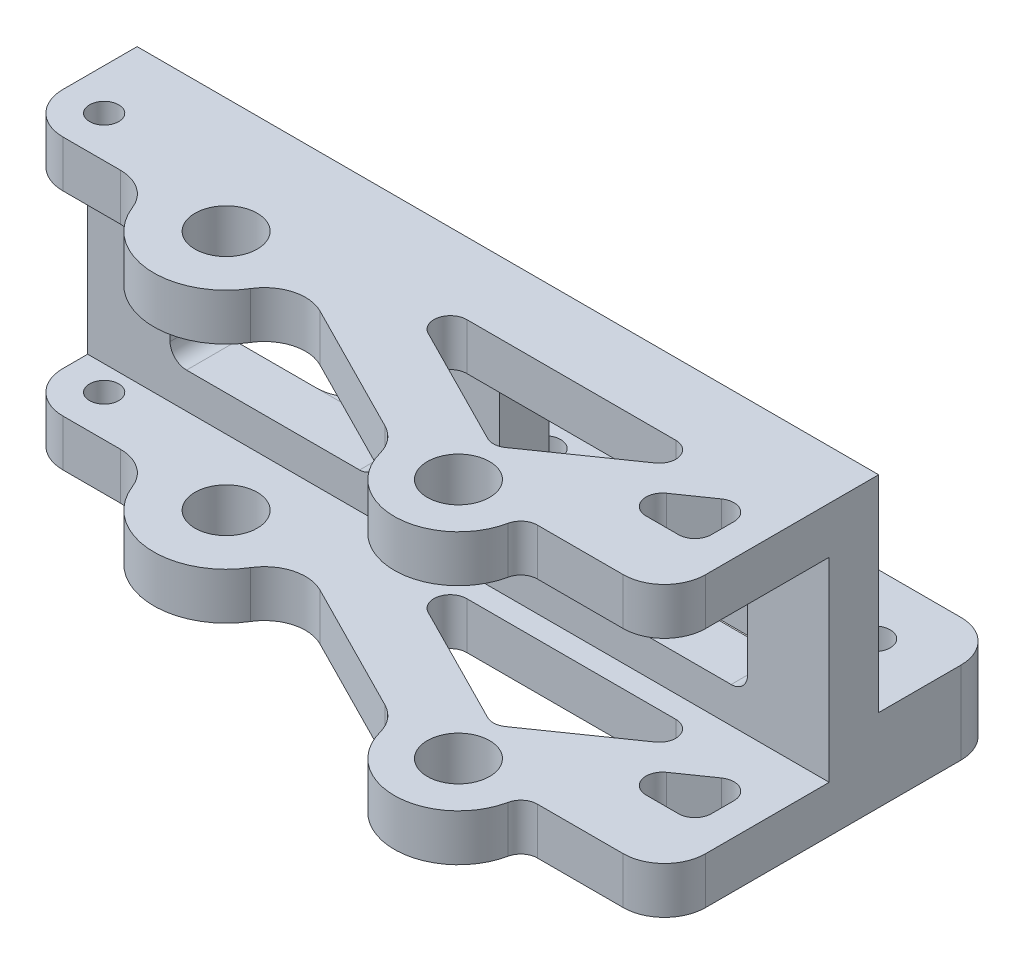
from build123d import *

# Parameters (mm, degrees)
SKETCH1_W               = 114.3
SKETCH1_H               = 44.45
BOSS_EXTRUDE1_DEPTH     = 64.77
SKETCH2_W               = 114.3
SKETCH2_H               = 30.050000124
CUT_EXTRUDE2_DEPTH      = 35.56
SKETCH3_W               = 114.3
SKETCH3_H               = 31.75
CUT_EXTRUDE3_DEPTH      = 21.59
SKETCH5_R               = 2.415
CUT_EXTRUDE4_DEPTH      = 25.4
CUT_EXTRUDE6_REACH      = 99.145
SKETCH7_R               = 4.8
CUT_EXTRUDE7_DEPTH      = 71.884319317
CUT_EXTRUDE7_DEPTH_BACK = 71.884319317
SKETCH9_W               = 31.75
SKETCH9_H               = 30.050000124
CUT_EXTRUDE8_DEPTH      = 98.144623629
BOSS_EXTRUDE2_REACH     = 99.632
SKETCH14_W              = 21.59
SKETCH14_H              = 5.500000062
SKETCH17_W              = 31.75
SKETCH17_H              = 5.500000062
BOSS_EXTRUDE3_DEPTH     = 7.62
SKETCH25_W              = 10.16
SKETCH25_H              = 7.199999938
BOSS_EXTRUDE5_DEPTH     = 20.35
F_8_CLEARANCE_HOLE1_D   = 4.4958
SKETCH31_W              = 114.3
SKETCH31_H              = 12.7
CUT_EXTRUDE9_DEPTH      = 2.54
CUT_EXTRUDE10_DEPTH     = 97.958161596
FILLET2_R               = 2.54
FILLET3_R               = 6.35
CUT_EXTRUDE11_DEPTH     = 97.958161596
SKETCH36_W              = 38.225
SKETCH36_H              = 24.550000062
CUT_EXTRUDE12_DEPTH     = 71.744268496
FILLET1_START           = -22.225
FILLET1_DEPTH           = 7.199999938
FILLET1_START_2         = 15.025000062
FILLET1_2_DEPTH         = 7.199999938
FILLET1_START_3         = -15.025000062
FILLET1_3_DEPTH         = 5.500000062
FILLET4_R               = 2.54


with BuildPart() as part:
    # Sketch1 → Boss-Extrude1 (new body)
    with BuildSketch(Plane.XY):
        Rectangle(SKETCH1_W, SKETCH1_H)
    extrude(amount=BOSS_EXTRUDE1_DEPTH)

    # Sketch2 → Cut-Extrude2 (cut)
    with BuildSketch(Plane.XY.offset(64.77)):
        Rectangle(SKETCH2_W, SKETCH2_H)
    extrude(amount=-CUT_EXTRUDE2_DEPTH, mode=Mode.SUBTRACT)

    # Sketch3 → Cut-Extrude3 (cut)
    with BuildSketch(Plane(origin=(0, 0, 0), x_dir=(-1, 0, 0), z_dir=(0, 0, -1))):
        with Locations((0, 6.35)):
            Rectangle(SKETCH3_W, SKETCH3_H)
    extrude(amount=-CUT_EXTRUDE3_DEPTH, mode=Mode.SUBTRACT)

    # Sketch5 → Cut-Extrude4 (cut)
    with BuildSketch(Plane.XZ.offset(22.225)):
        with Locations((-3.81, 12.06)):
            Circle(SKETCH5_R)
        with Locations((46.99, 12.06)):
            Circle(SKETCH5_R)
    extrude(amount=-CUT_EXTRUDE4_DEPTH, mode=Mode.SUBTRACT)

    # Cut-Extrude6: up to this face of the body (flat: up to its plane)
    cut_extrude6_end = Plane(part.part.faces().sort_by_distance((0, 22.225, 43.18))[0])
    # Sketch7 → Cut-Extrude6 (cut, up to the picked face)
    with BuildSketch(Plane.XZ.offset(22.225), mode=Mode.PRIVATE) as cut_extrude6_sk1:
        with Locations((25.4, 54.61)):
            Circle(SKETCH7_R)
    cut_extrude6_tool1 = split(extrude(cut_extrude6_sk1.sketch, amount=-CUT_EXTRUDE6_REACH, mode=Mode.PRIVATE), bisect_by=cut_extrude6_end, keep=Keep.BOTH, mode=Mode.PRIVATE)
    # Sketch7 → Cut-Extrude6 (cut, up to the picked face)
    with BuildSketch(Plane.XZ.offset(22.225), mode=Mode.PRIVATE) as cut_extrude6_sk2:
        with Locations((-25.65, 39.37)):
            Circle(SKETCH7_R)
    cut_extrude6_tool2 = split(extrude(cut_extrude6_sk2.sketch, amount=-CUT_EXTRUDE6_REACH, mode=Mode.PRIVATE), bisect_by=cut_extrude6_end, keep=Keep.BOTH, mode=Mode.PRIVATE)
    add(cut_extrude6_tool1.solids().sort_by(Axis((25.4, -22.225, 54.61), (0, 1, 0)))[0], mode=Mode.SUBTRACT)
    add(cut_extrude6_tool2.solids().sort_by(Axis((-25.65, -22.225, 39.37), (0, 1, 0)))[0], mode=Mode.SUBTRACT)

    # Sketch9 → Cut-Extrude7 (cut, two sides: drawn at the far end of the back side and taken through both)
    with BuildSketch(Plane.XY.offset(29.21).offset(-CUT_EXTRUDE7_DEPTH_BACK)):
        with Locations((-28.575, 0)):
            Rectangle(SKETCH9_W, SKETCH9_H)
    extrude(amount=CUT_EXTRUDE7_DEPTH + CUT_EXTRUDE7_DEPTH_BACK, mode=Mode.SUBTRACT)

    # Sketch16 → Cut-Extrude8 (cut, through all)
    with BuildSketch(Plane.XZ.offset(22.225)):
        with BuildLine():
            Line((-36.8, 39.37), (-36.8, 29.21))
            Line((-36.8, 29.21), (-49.091020336, 29.21))
            Line((-49.091020336, 29.21), (-57.15, 29.21))
            Line((-57.15, 29.21), (-57.15, 64.77))
            Line((-57.15, 64.77), (57.15, 64.77))
            Line((57.15, 64.77), (57.15, 54.61))
            Line((57.15, 54.61), (35.28, 54.61))
            ThreePointArc((35.28, 54.61), (25.4, 64.49), (15.52, 54.61))
            Line((15.52, 54.61), (-14.5, 39.37))
            ThreePointArc((-14.5, 39.37), (-25.65, 50.52), (-36.8, 39.37))
        make_face()
    extrude(amount=-CUT_EXTRUDE8_DEPTH, mode=Mode.SUBTRACT)

    # Sketch14 → Boss-Extrude2 (add, up to next)
    with BuildSketch(Plane.ZY.offset(12.7), mode=Mode.PRIVATE) as boss_extrude2_sk1:
        with Locations((10.795, -12.275000031)):
            Rectangle(SKETCH14_W, SKETCH14_H)
    boss_extrude2_tool1 = extrude(boss_extrude2_sk1.sketch, amount=BOSS_EXTRUDE2_REACH, mode=Mode.PRIVATE) - part.part
    add(boss_extrude2_tool1.solids().sort_by_distance((-12.7, -12.275, 10.795))[0])

    # Sketch17 → Boss-Extrude3 (add)
    with BuildSketch(Plane.XY.offset(21.59)):
        with Locations((-28.575, -12.275000031)):
            Rectangle(SKETCH17_W, SKETCH17_H)
    extrude(amount=BOSS_EXTRUDE3_DEPTH)

    # Sketch25 → Boss-Extrude5 (add)
    with BuildSketch(Plane.ZY.offset(36.8)):
        with Locations((34.29, 18.625000031)):
            Rectangle(SKETCH25_W, SKETCH25_H)
        with Locations((34.29, -18.625000031)):
            Rectangle(SKETCH25_W, SKETCH25_H)
    extrude(amount=BOSS_EXTRUDE5_DEPTH)

    # #8 Clearance Hole1 (through all)
    with Locations(Plane(origin=(0, -22.225, 0), x_dir=(-1, 0, 0), z_dir=(0, -1, 0))):
        with Locations((50.8, -33.02)):
            Hole(F_8_CLEARANCE_HOLE1_D / 2)

    # Sketch31 → Cut-Extrude9 (cut)
    with BuildSketch(Plane(origin=(0, 0, 0), x_dir=(-1, 0, 0), z_dir=(0, 0, -1))):
        with Locations((0, -15.875)):
            Rectangle(SKETCH31_W, SKETCH31_H)
    extrude(amount=-CUT_EXTRUDE9_DEPTH, mode=Mode.SUBTRACT)

    # Sketch32 → Cut-Extrude10 (cut, through all)
    with BuildSketch(Plane.XZ.offset(22.225)):
        Polygon((-5.918169451, 32.620968913), (23.531635553, 47.571502833), (45.002146373, 32.620968913), align=None)
        Polygon((36.641912944, 45.021511278), (52.262098779, 45.021511278), (52.262098779, 34.144726831), align=None)
        Polygon((-57.15, 2.54), (-7.267358513, 2.54), (-26.98878189, 21.59), (-57.15, 21.59), align=None)
    extrude(amount=-CUT_EXTRUDE10_DEPTH, mode=Mode.SUBTRACT)

    # Fillet2
    fillet2_edges = [part.edges().sort_by_distance(p)[0] for p in [
        (35.28, 18.625000031, 54.61),
        (35.28, -18.625000031, 54.61),
    ]]
    fillet(fillet2_edges, radius=FILLET2_R)

    # Fillet3
    fillet3_edges = [part.edges().sort_by_distance(p)[0] for p in [
        (57.15, 18.625000031, 54.61),
        (57.15, -18.625000031, 54.61),
        (15.52, 18.625000031, 54.61),
        (15.52, -18.625000031, 54.61),
        (-14.5, 18.625000031, 39.37),
        (-14.5, -18.625000031, 39.37),
        (-36.8, 18.625000031, 39.37),
        (-36.8, -18.625000031, 39.37),
        (-57.15, 18.625000031, 39.37),
        (-57.15, -18.625000031, 39.37),
        (57.15, -15.875, 2.54),
        (-7.267358513, -15.875, 2.54),
        (-26.98878189, -15.875, 21.59),
    ]]
    fillet(fillet3_edges, radius=FILLET3_R)

    # Sketch35 → Cut-Extrude11 (cut, through all)
    with BuildSketch(Plane.XZ.offset(22.225)):
        Polygon((-4.463452319, 21.59), (47.188828945, 21.59), (34.29, 8.691171055), (8.89, 8.691171055), align=None)
    extrude(amount=-CUT_EXTRUDE11_DEPTH, mode=Mode.SUBTRACT)

    # Sketch36 → Cut-Extrude12 (cut, through all)
    with BuildSketch(Plane.XY.offset(29.21)):
        with Locations((25.4625, 2.750000031)):
            Rectangle(SKETCH36_W, SKETCH36_H)
    extrude(amount=-CUT_EXTRUDE12_DEPTH, mode=Mode.SUBTRACT)

    # Fillet1: read off the stored shape, not the designer's step
    # Fillet1 outline → Fillet1 (add)
    with BuildSketch(Plane(origin=(0, 0, 0), x_dir=(1, 0, 0), z_dir=(0, 1, 0)).offset(FILLET1_START)):
        with BuildLine():
            ThreePointArc((42.85277772, -17.253948776), (43.403380509, -20.022015918), (41.056726496, -21.59))
            Line((41.056726496, -21.59), (47.188828945, -21.59))
            Line((47.188828945, -21.59), (42.85277772, -17.253948776))
        make_face()
        with BuildLine():
            Line((-4.463452319, -21.59), (1.822023727, -21.59))
            ThreePointArc((1.822023727, -21.59), (-0.532957822, -20.001662705), (0.057340176, -17.223119609))
            Line((0.057340176, -17.223119609), (-4.463452319, -21.59))
        make_face()
        with BuildLine():
            ThreePointArc((33.237897552, -8.691171055), (34.20991347, -8.884517043), (35.033948776, -9.435119831))
            Line((35.033948776, -9.435119831), (34.29, -8.691171055))
            Line((34.29, -8.691171055), (33.237897552, -8.691171055))
        make_face()
        with BuildLine():
            Line((8.89, -8.691171055), (8.151746261, -9.404290664))
            ThreePointArc((8.151746261, -9.404290664), (8.964767108, -8.876189506), (9.916429813, -8.691171055))
            Line((9.916429813, -8.691171055), (8.89, -8.691171055))
        make_face()
        with BuildLine():
            ThreePointArc((3.546525324, -37.425830617), (2.226050592, -34.56984656), (4.696308547, -32.620968913))
            Line((4.696308547, -32.620968913), (-5.918169451, -32.620968913))
            Line((-5.918169451, -32.620968913), (3.546525324, -37.425830617))
        make_face()
        with BuildLine():
            Line((45.002146373, -32.620968913), (36.909521955, -32.620968913))
            ThreePointArc((36.909521955, -32.620968913), (39.332956728, -34.400335032), (38.360975969, -37.245406786))
            Line((38.360975969, -37.245406786), (45.002146373, -32.620968913))
        make_face()
        with BuildLine():
            ThreePointArc((24.77830006, -46.703414497), (23.502600153, -47.152888717), (22.177062823, -46.883838328))
            Line((22.177062823, -46.883838328), (23.531635553, -47.571502833))
            Line((23.531635553, -47.571502833), (24.77830006, -46.703414497))
        make_face()
        with BuildLine():
            ThreePointArc((44.734537362, -45.021511278), (42.311102589, -43.24214516), (43.283083348, -40.397073406))
            Line((43.283083348, -40.397073406), (36.641912944, -45.021511278))
            Line((36.641912944, -45.021511278), (44.734537362, -45.021511278))
        make_face()
        with BuildLine():
            Line((52.262098779, -34.144726831), (48.270644765, -36.924091008))
            ThreePointArc((48.270644765, -36.924091008), (50.897876565, -36.757052343), (52.262098779, -39.008528881))
            Line((52.262098779, -39.008528881), (52.262098779, -34.144726831))
        make_face()
        with BuildLine():
            ThreePointArc((52.262098779, -42.481511278), (51.518150003, -44.277562502), (49.722098779, -45.021511278))
            Line((49.722098779, -45.021511278), (52.262098779, -45.021511278))
            Line((52.262098779, -45.021511278), (52.262098779, -42.481511278))
        make_face()
    extrude(amount=FILLET1_DEPTH)

    # Fillet1 2 outline → Fillet1 2 (add)
    with BuildSketch(Plane(origin=(0, 0, 0), x_dir=(1, 0, 0), z_dir=(0, 1, 0)).offset(FILLET1_START_2)):
        with BuildLine():
            ThreePointArc((3.546525324, -37.425830617), (2.226050592, -34.56984656), (4.696308547, -32.620968913))
            Line((4.696308547, -32.620968913), (-5.918169451, -32.620968913))
            Line((-5.918169451, -32.620968913), (3.546525324, -37.425830617))
        make_face()
        with BuildLine():
            Line((45.002146373, -32.620968913), (36.909521955, -32.620968913))
            ThreePointArc((36.909521955, -32.620968913), (39.332956728, -34.400335032), (38.360975969, -37.245406786))
            Line((38.360975969, -37.245406786), (45.002146373, -32.620968913))
        make_face()
        with BuildLine():
            ThreePointArc((24.77830006, -46.703414497), (23.502600153, -47.152888717), (22.177062823, -46.883838328))
            Line((22.177062823, -46.883838328), (23.531635553, -47.571502833))
            Line((23.531635553, -47.571502833), (24.77830006, -46.703414497))
        make_face()
        with BuildLine():
            ThreePointArc((44.734537362, -45.021511278), (42.311102589, -43.24214516), (43.283083348, -40.397073406))
            Line((43.283083348, -40.397073406), (36.641912944, -45.021511278))
            Line((36.641912944, -45.021511278), (44.734537362, -45.021511278))
        make_face()
        with BuildLine():
            Line((52.262098779, -34.144726831), (48.270644765, -36.924091008))
            ThreePointArc((48.270644765, -36.924091008), (50.897876565, -36.757052343), (52.262098779, -39.008528881))
            Line((52.262098779, -39.008528881), (52.262098779, -34.144726831))
        make_face()
        with BuildLine():
            ThreePointArc((52.262098779, -42.481511278), (51.518150003, -44.277562502), (49.722098779, -45.021511278))
            Line((49.722098779, -45.021511278), (52.262098779, -45.021511278))
            Line((52.262098779, -45.021511278), (52.262098779, -42.481511278))
        make_face()
    extrude(amount=FILLET1_2_DEPTH)

    # Fillet1 3 outline → Fillet1 3 (add)
    with BuildSketch(Plane(origin=(0, 0, 0), x_dir=(1, 0, 0), z_dir=(0, 1, 0)).offset(FILLET1_START_3)):
        with BuildLine():
            ThreePointArc((42.85277772, -17.253948776), (43.403380509, -20.022015918), (41.056726496, -21.59))
            Line((41.056726496, -21.59), (47.188828945, -21.59))
            Line((47.188828945, -21.59), (42.85277772, -17.253948776))
        make_face()
        with BuildLine():
            Line((-4.463452319, -21.59), (1.822023727, -21.59))
            ThreePointArc((1.822023727, -21.59), (-0.532957822, -20.001662705), (0.057340176, -17.223119609))
            Line((0.057340176, -17.223119609), (-4.463452319, -21.59))
        make_face()
        with BuildLine():
            ThreePointArc((33.237897552, -8.691171055), (34.20991347, -8.884517043), (35.033948776, -9.435119831))
            Line((35.033948776, -9.435119831), (34.29, -8.691171055))
            Line((34.29, -8.691171055), (33.237897552, -8.691171055))
        make_face()
        with BuildLine():
            Line((8.89, -8.691171055), (8.151746261, -9.404290664))
            ThreePointArc((8.151746261, -9.404290664), (8.964767108, -8.876189506), (9.916429813, -8.691171055))
            Line((9.916429813, -8.691171055), (8.89, -8.691171055))
        make_face()
    extrude(amount=FILLET1_3_DEPTH)

    # Fillet4
    fillet4_edges = [part.edges().sort_by_distance(p)[0] for p in [
        (-12.7, -9.525, 25.4),
        (-44.45, -9.525, 25.4),
        (6.35, -9.525, 25.4),
        (6.35, 15.025000062, 25.4),
        (44.575, 15.025000062, 25.4),
        (44.575, -9.525, 25.4),
        (-12.7, 15.025000062, 25.4),
        (-44.45, 15.025000062, 25.4),
    ]]
    fillet(fillet4_edges, radius=FILLET4_R)


solid = part.part
